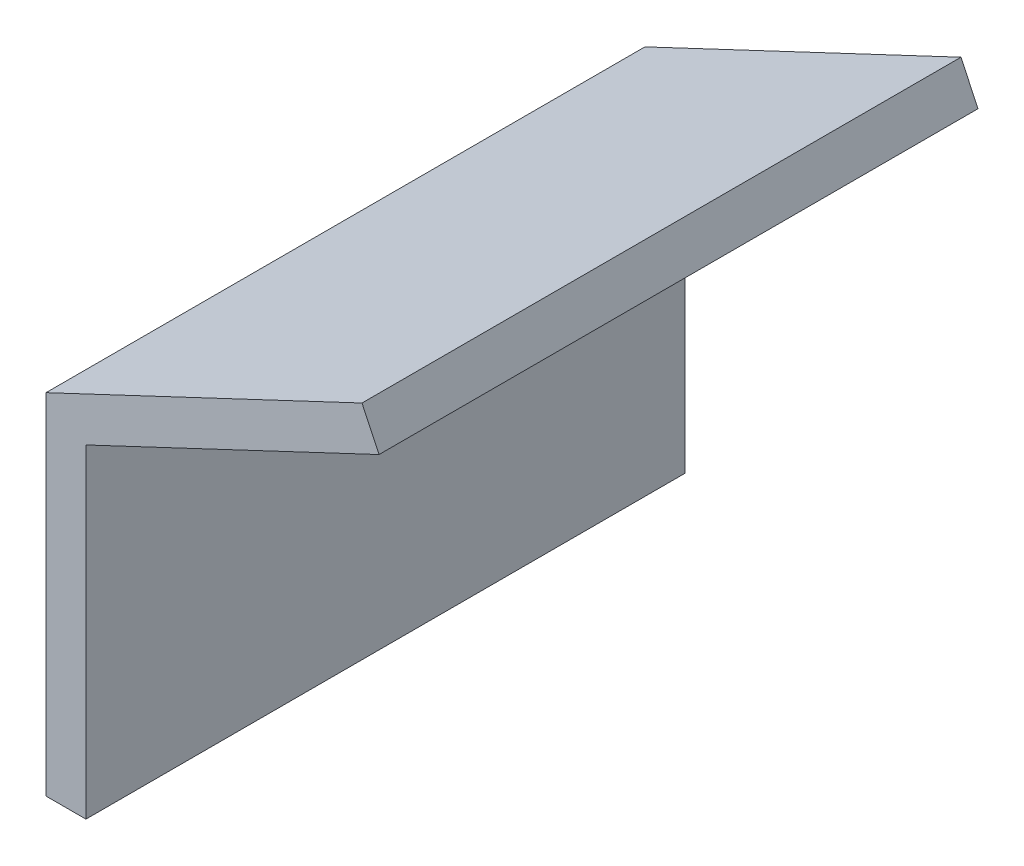
from build123d import *

# Parameters (mm, degrees)
BOSS_EXTRUDE1_DEPTH = 60


with BuildPart() as part:
    # Sketch1 → Boss-Extrude1 (new, symmetric)
    with BuildSketch(Plane.XY):
        Polygon((0, 0), (63.311860182, 29.859811793), (66.724410101, 22.624170629), (8, -5.072059243), (8, -70), (0, -70), align=None)
    extrude(amount=BOSS_EXTRUDE1_DEPTH, both=True)


solid = part.part
